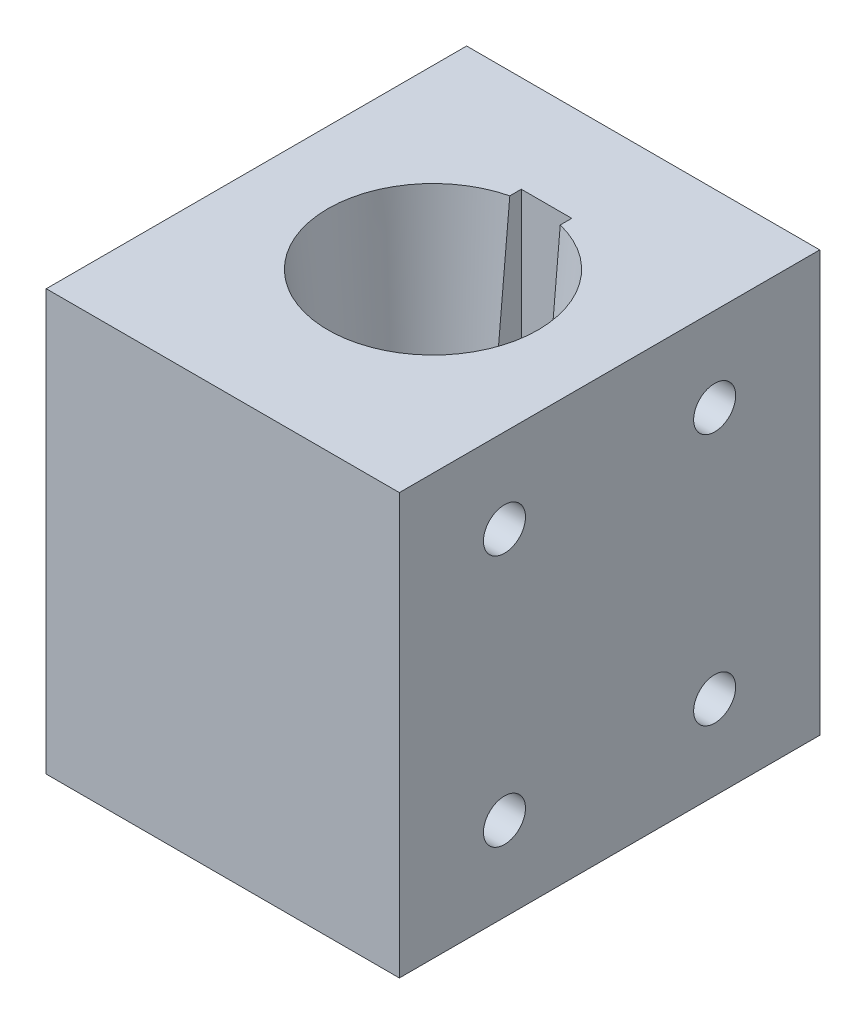
from build123d import *

# Parameters (mm, degrees)
SZKIC6_W                        = 42
SZKIC6_H                        = 50
DODANIE_WYCI_GNI_CIE3_DEPTH     = 25
WYTNIJ_WYCI_GNI_CIE1_REACH      = 61.716
SZKIC8_W                        = 6
SZKIC8_H                        = 13.5
OTW_R_GWINTOWANY_M62_AT_2_COUNT = 2
OTW_R_GWINTOWANY_M62_AT_2_PITCH = 25
OTW_R_GWINTOWANY_M62_AT_3_COUNT = 2
OTW_R_GWINTOWANY_M62_AT_3_PITCH = 39.05124838
OTW_R_GWINTOWANY_M62_AT_4_COUNT = 2
OTW_R_GWINTOWANY_M62_AT_4_PITCH = 30
SZKIC11_R                       = 12.5
WYTNIJ_WYCI_GNI_CIE2_DEPTH      = 12


with BuildPart() as part:
    # Szkic6 → Dodanie-wyciągnięcie3 (new, symmetric)
    with BuildSketch(Plane(origin=(0, 0, 0), x_dir=(1, 0, 0), z_dir=(0, 1, 0))):
        Rectangle(SZKIC6_W, SZKIC6_H)
    extrude(amount=DODANIE_WYCI_GNI_CIE3_DEPTH, both=True)

    # Szkic7 → Wycięcie-obrót1 (revolve, cut)
    with BuildSketch(Plane(origin=(0, 0, 0), x_dir=(0, 0, -1), z_dir=(1, 0, 0))):
        Polygon((0, 25), (-12.5, 25), (-8.125566824, -25), (0, -25), align=None)
    revolve(axis=Axis((0, 25, 0), (0, -1, 0)), mode=Mode.SUBTRACT)

    # Szkic8 → Wytnij-wyciągnięcie1 (cut, up to next)
    with BuildSketch(Plane(origin=(0, 25, 0), x_dir=(1, 0, 0), z_dir=(0, 1, 0)), mode=Mode.PRIVATE) as wytnij_wyci_gni_cie1_sk1:
        with Locations((0, 6.75)):
            Rectangle(SZKIC8_W, SZKIC8_H)
    wytnij_wyci_gni_cie1_tool1 = extrude(wytnij_wyci_gni_cie1_sk1.sketch, amount=-WYTNIJ_WYCI_GNI_CIE1_REACH, mode=Mode.PRIVATE) & part.part
    add(wytnij_wyci_gni_cie1_tool1.solids().sort_by_distance((0, 25, -6.75))[0], mode=Mode.SUBTRACT)

    # Szkic10 → Otwór gwintowany M62 (revolve, cut)
    with BuildSketch(Plane(origin=(21, 15, 12.5), x_dir=(0, 0, -1), z_dir=(0, 1, 0))):
        Polygon((0, 0), (0, 14.502151548), (2.5, 13), (2.5, 0), align=None)
    otw_r_gwintowany_m62 = revolve(axis=Axis((27.35, 15, 12.5), (-1, 0, 0)), mode=Mode.SUBTRACT)

    # Otwór gwintowany M62 at 2: Otwór gwintowany M62 ×2
    with Locations(*[(0, 0, -i * OTW_R_GWINTOWANY_M62_AT_2_PITCH) for i in range(1, OTW_R_GWINTOWANY_M62_AT_2_COUNT)]):
        add(otw_r_gwintowany_m62, mode=Mode.SUBTRACT)

    # Otwór gwintowany M62 at 3: Otwór gwintowany M62 ×2
    with Locations(*[Vector(0, -0.7682212795973757, -0.6401843996644799) * (i * OTW_R_GWINTOWANY_M62_AT_3_PITCH) for i in range(1, OTW_R_GWINTOWANY_M62_AT_3_COUNT)]):
        add(otw_r_gwintowany_m62, mode=Mode.SUBTRACT)

    # Otwór gwintowany M62 at 4: Otwór gwintowany M62 ×2
    with Locations(*[(0, -i * OTW_R_GWINTOWANY_M62_AT_4_PITCH, 0) for i in range(1, OTW_R_GWINTOWANY_M62_AT_4_COUNT)]):
        add(otw_r_gwintowany_m62, mode=Mode.SUBTRACT)

    # Lustro2: Otwór gwintowany M62 across plane
    add(otw_r_gwintowany_m62.mirror(Plane(origin=(0, 0, 0), x_dir=(0, 0, 1), z_dir=(1, 0, 0))), mode=Mode.SUBTRACT)

    # Lustro2 copy 1 sketch → Lustro2 copy 1 (revolve, cut)
    with BuildSketch(Plane(origin=(-21, 15, -12.5), x_dir=(0, 0, -1), z_dir=(0, 1, 0))):
        Polygon((0, 0), (0, -14.502151548), (2.5, -13), (2.5, 0), align=None)
    revolve(axis=Axis((-27.35, 15, -12.5), (-1, 0, 0)), mode=Mode.SUBTRACT)

    # Lustro2 copy 2 sketch → Lustro2 copy 2 (revolve, cut)
    with BuildSketch(Plane(origin=(-21, -15, -12.5), x_dir=(0, 0, -1), z_dir=(0, 1, 0))):
        Polygon((0, 0), (0, -14.502151548), (2.5, -13), (2.5, 0), align=None)
    revolve(axis=Axis((-27.35, -15, -12.5), (-1, 0, 0)), mode=Mode.SUBTRACT)

    # Lustro2 copy 3 sketch → Lustro2 copy 3 (revolve, cut)
    with BuildSketch(Plane(origin=(-21, -15, 12.5), x_dir=(0, 0, -1), z_dir=(0, 1, 0))):
        Polygon((0, 0), (0, -14.502151548), (2.5, -13), (2.5, 0), align=None)
    revolve(axis=Axis((-27.35, -15, 12.5), (-1, 0, 0)), mode=Mode.SUBTRACT)

    # Szkic11 → Wytnij-wyciągnięcie2 (cut)
    with BuildSketch(Plane.XZ.offset(25)):
        Circle(SZKIC11_R)
    extrude(amount=-WYTNIJ_WYCI_GNI_CIE2_DEPTH, mode=Mode.SUBTRACT)


solid = part.part
